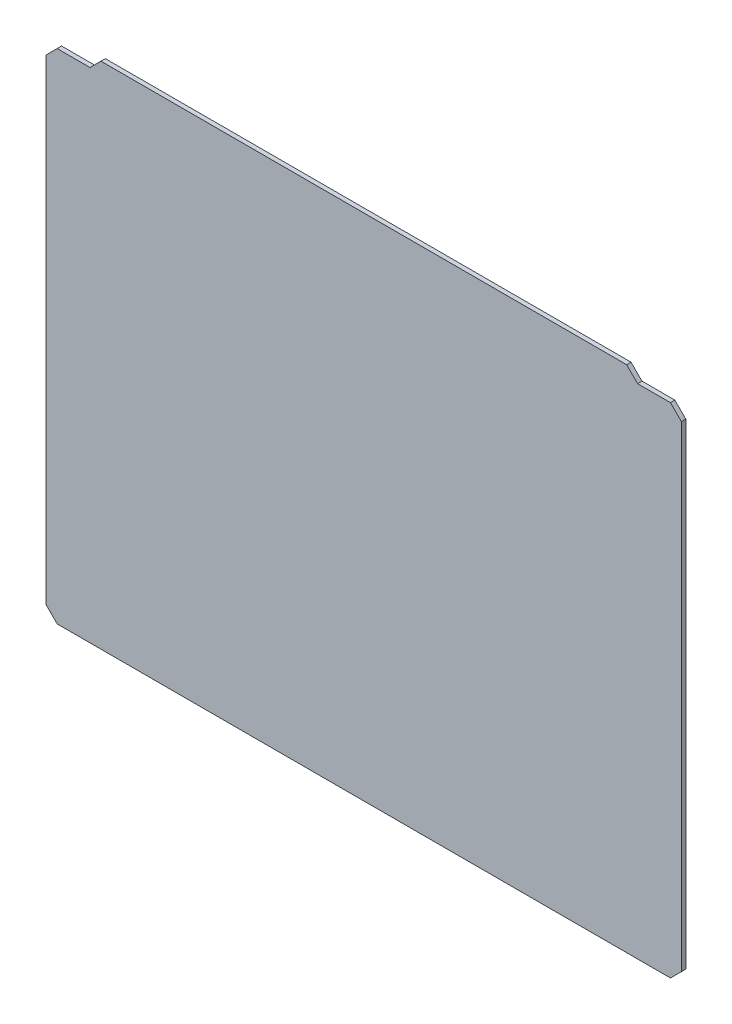
from build123d import *

# Parameters (mm, degrees)
BOSS_EXTRUDE1_DEPTH = 4
CHAMFER1_SIZE       = 10
CHAMFER2_SIZE       = 10


with BuildPart() as part:
    # Sketch1 → Boss-Extrude1 (new body)
    with BuildSketch(Plane.XY):
        Polygon((-41, -5), (-1, -5), (-1, 5), (499, 5), (499, -5), (539, -5), (539, -420), (539, -460), (497, -460), (1, -460), (-41, -460), (-41, -420), align=None)
    extrude(amount=BOSS_EXTRUDE1_DEPTH)

    # Chamfer1
    chamfer1_edges = [part.edges().sort_by_distance(p)[0] for p in [
        (499, 5, 2),
        (-1, 5, 2),
    ]]
    chamfer(chamfer1_edges, length=CHAMFER1_SIZE - 0.0001)  # a hair under: the kernel refuses the full size

    # Chamfer2
    chamfer2_edges = [part.edges().sort_by_distance(p)[0] for p in [
        (539, -5, 2),
        (539, -460, 2),
        (-41, -460, 2),
        (-41, -5, 2),
    ]]
    chamfer(chamfer2_edges, length=CHAMFER2_SIZE)


solid = part.part
